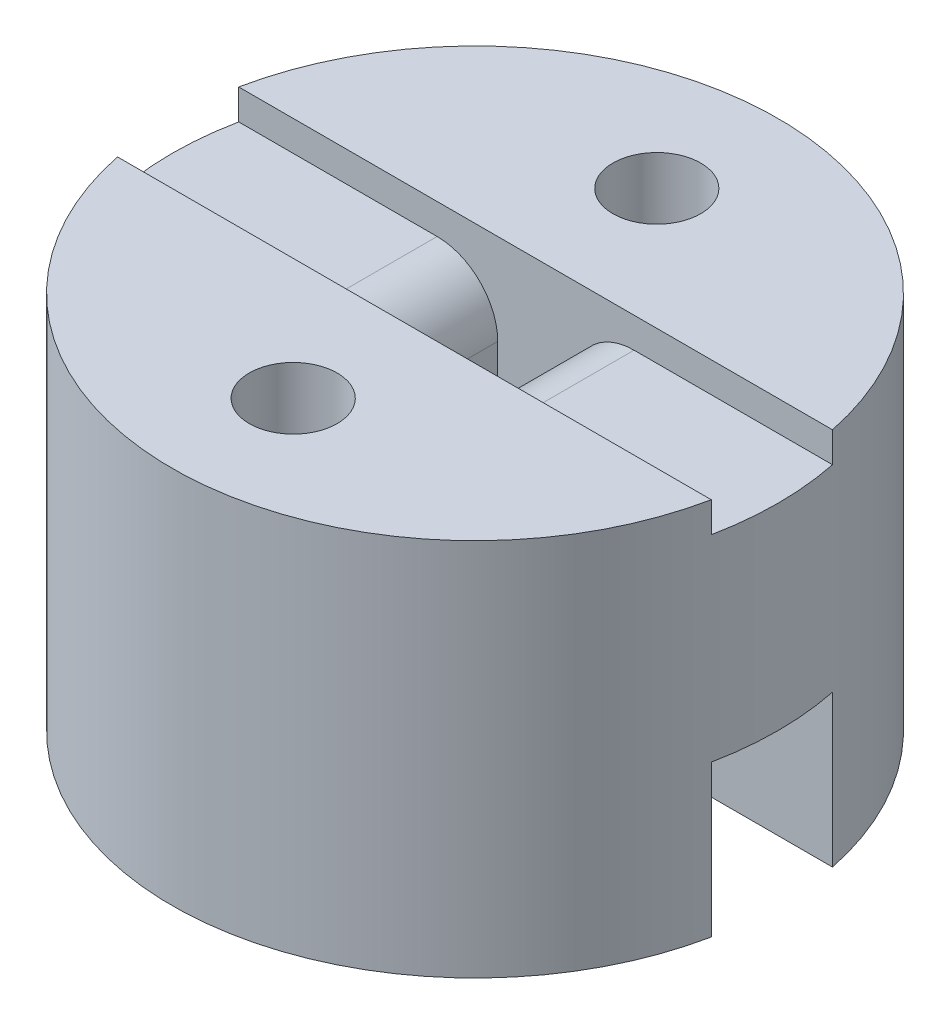
from build123d import *

# Parameters (mm, degrees)
SKETCH1_R               = 20
BOSS_EXTRUDE1_DEPTH     = 25
SKETCH2_W               = 40
SKETCH2_H               = 8
CUT_EXTRUDE1_DEPTH      = 2
M5_CLEARANCE_HOLE1_D    = 5.8
CUT_EXTRUDE2_DEPTH      = 6
CUT_EXTRUDE3_DEPTH      = 37.455452267
CUT_EXTRUDE3_DEPTH_BACK = 37.455452267
SKETCH6_W               = 5
SKETCH6_H               = 8
SKETCH7_W               = 40
SKETCH7_H               = 8
CUT_EXTRUDE4_DEPTH      = 10
FILLET1_R               = 4


with BuildPart() as part:
    # Sketch1 → Boss-Extrude1 (new body)
    with BuildSketch(Plane(origin=(0, 0, 0), x_dir=(1, 0, 0), z_dir=(0, 1, 0))):
        Circle(SKETCH1_R)
    extrude(amount=BOSS_EXTRUDE1_DEPTH)

    # Sketch2 → Cut-Extrude1 (cut)
    with BuildSketch(Plane(origin=(0, 25, 0), x_dir=(1, 0, 0), z_dir=(0, 1, 0))):
        Rectangle(SKETCH2_W, SKETCH2_H)
    extrude(amount=-CUT_EXTRUDE1_DEPTH, mode=Mode.SUBTRACT)

    # M5 Clearance Hole1 (through all)
    with Locations(Plane(origin=(0, 25, -12), x_dir=(0, 0, 1), z_dir=(0, 1, 0))):
        with Locations((0, 0), (24, 0)):
            Hole(M5_CLEARANCE_HOLE1_D / 2)

    # Sketch5 → Cut-Extrude2 (cut)
    with BuildSketch(Plane.XZ):
        Polygon((4.907477288, 12), (2.453738644, 16.25), (-2.453738644, 16.25), (-4.907477288, 12), (-2.453738644, 7.75), (2.453738644, 7.75), align=None)
        Polygon((4.907477288, -12), (2.453738644, -7.75), (-2.453738644, -7.75), (-4.907477288, -12), (-2.453738644, -16.25), (2.453738644, -16.25), align=None)
    extrude(amount=-CUT_EXTRUDE2_DEPTH, mode=Mode.SUBTRACT)

    # Sketch6 → Cut-Extrude3 (cut, two sides: drawn at the far end of the back side and taken through both)
    with BuildSketch(Plane(origin=(0, 23, 0), x_dir=(1, 0, 0), z_dir=(0, 1, 0)).offset(-CUT_EXTRUDE3_DEPTH_BACK)):
        Rectangle(SKETCH6_W, SKETCH6_H)
    extrude(amount=CUT_EXTRUDE3_DEPTH + CUT_EXTRUDE3_DEPTH_BACK, mode=Mode.SUBTRACT)

    # Sketch7 → Cut-Extrude4 (cut)
    with BuildSketch(Plane.XZ):
        Rectangle(SKETCH7_W, SKETCH7_H)
    extrude(amount=-CUT_EXTRUDE4_DEPTH, mode=Mode.SUBTRACT)

    # Fillet1
    fillet1_edges = [part.edges().sort_by_distance(p)[0] for p in [
        (-2.5, 23, 0),
        (2.5, 23, 0),
        (-2.5, 10, 0),
        (2.5, 10, 0),
    ]]
    fillet(fillet1_edges, radius=FILLET1_R)


solid = part.part
